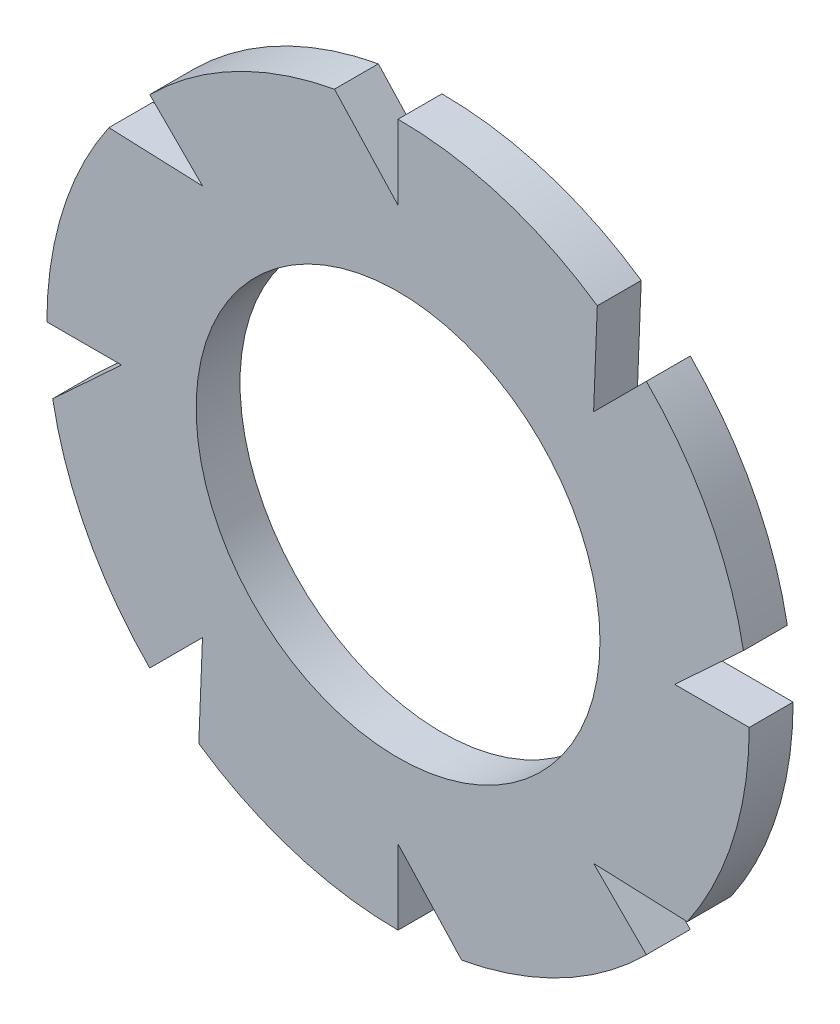
from build123d import *

# Parameters (mm, degrees)
SKETCH1_R          = 4
SKETCH1_R_2        = 2.3
BASE_EXTRUDE_DEPTH = 0.5
TYPEASLOT_DEPTH    = 8.913777726
TYPEAPATTERN_COUNT = 8


with BuildPart() as part:
    # Sketch1 → Base-Extrude (new body)
    with BuildSketch(Plane.XY):
        Circle(SKETCH1_R)
        Circle(SKETCH1_R_2, mode=Mode.SUBTRACT)
    extrude(amount=-BASE_EXTRUDE_DEPTH)

    # Sketch2 → TypeASlot (cut, through all)
    with BuildSketch(Plane(origin=(-0.6669983, 2.371577886, 0), x_dir=(1, 0, 0), z_dir=(0, 0, 1))):
        Polygon((0.6669983, 1.628422114), (0.6669983, 0.778422114), (-0.1183992, 1.628422114), align=None)
    typeaslot = extrude(amount=-TYPEASLOT_DEPTH, mode=Mode.SUBTRACT)

    # TypeAPattern: TypeASlot ×8 about axis
    typeapattern_axis = Axis((0, 0, -0.5), (0, 0, 1))
    for i in range(1, TYPEAPATTERN_COUNT):
        add(typeaslot.rotate(typeapattern_axis, i * 360 / TYPEAPATTERN_COUNT), mode=Mode.SUBTRACT)


solid = part.part
